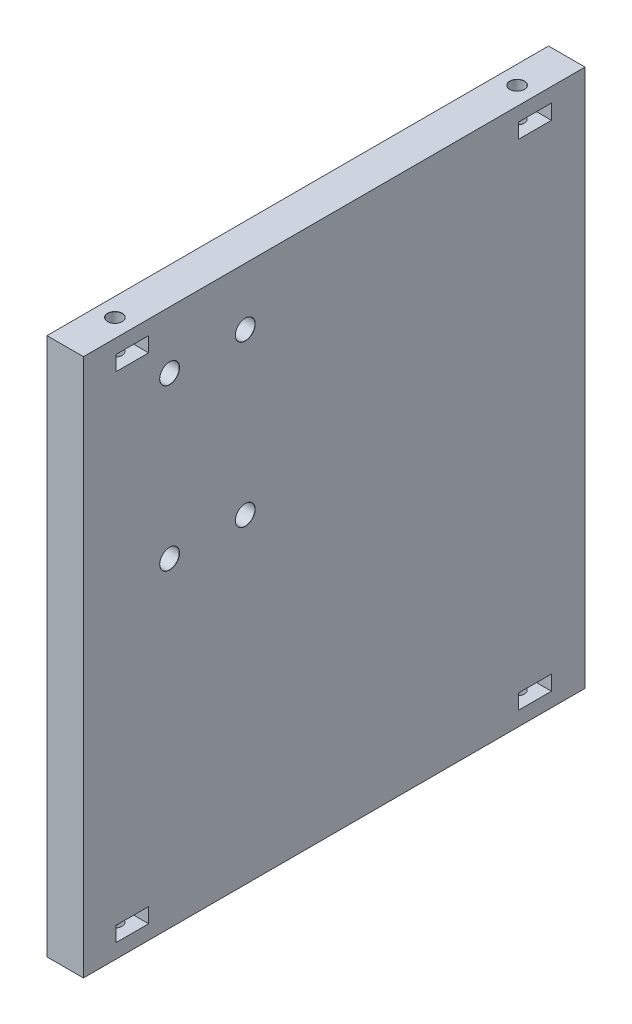
from build123d import *

# Parameters (mm, degrees)
SKETCH1_W                             = 87.3
SKETCH1_H                             = 93.65
BOSS_EXTRUDE1_DEPTH                   = 6.35
TAP_DRILL_FOR_M3X0_5_TAP1_D           = 2.5
TAP_DRILL_FOR_M3X0_5_TAP1_DEPTH       = 10
TAP_DRILL_FOR_M3X0_5_TAP1_CSINK_D     = 2.55
TAP_DRILL_FOR_M3X0_5_TAP1_CSINK_ANGLE = 90
TAP_DRILL_FOR_M3X0_5_TAP1_TIP         = 0.751075774
TAP_DRILL_FOR_M3X0_5_TAP2_D           = 2.5
TAP_DRILL_FOR_M3X0_5_TAP2_DEPTH       = 9.248924226
TAP_DRILL_FOR_M3X0_5_TAP2_CSINK_D     = 2.55
TAP_DRILL_FOR_M3X0_5_TAP2_CSINK_ANGLE = 90
TAP_DRILL_FOR_M3X0_5_TAP2_TIP         = 0.751075774
M3_CLEARANCE_HOLE2_D                  = 3.4
M3_CLEARANCE_HOLE2_CSINK_D            = 3.45
M3_CLEARANCE_HOLE2_CSINK_ANGLE        = 90
SKETCH24_W                            = 5.7
SKETCH24_H                            = 2.6
CUT_EXTRUDE1_DEPTH                    = 65.329041847


with BuildPart() as part:
    # Sketch1 → Boss-Extrude1 (new body)
    with BuildSketch(Plane(origin=(0, 0, 0), x_dir=(0, 0, -1), z_dir=(1, 0, 0))):
        Rectangle(SKETCH1_W, SKETCH1_H)
    extrude(amount=BOSS_EXTRUDE1_DEPTH)

    # Tap Drill for M3x0.5 Tap1
    with Locations(Plane(origin=(0, 46.825, 0), x_dir=(1, 0, 0), z_dir=(0, 1, 0))):
        with Locations((3.175, 35), (3.175, -35)):
            CounterSinkHole(TAP_DRILL_FOR_M3X0_5_TAP1_D / 2, TAP_DRILL_FOR_M3X0_5_TAP1_CSINK_D / 2, depth=TAP_DRILL_FOR_M3X0_5_TAP1_DEPTH, counter_sink_angle=TAP_DRILL_FOR_M3X0_5_TAP1_CSINK_ANGLE)
            with Locations((0, 0, -(TAP_DRILL_FOR_M3X0_5_TAP1_DEPTH + TAP_DRILL_FOR_M3X0_5_TAP1_TIP / 2))):  # 118° drill point
                Cone(0, TAP_DRILL_FOR_M3X0_5_TAP1_D / 2, TAP_DRILL_FOR_M3X0_5_TAP1_TIP, mode=Mode.SUBTRACT)

    # Tap Drill for M3x0.5 Tap2
    with Locations(Plane(origin=(0, -46.825, 0), x_dir=(-1, 0, 0), z_dir=(0, -1, 0))):
        with Locations((-3.175, -35), (-3.175, 35)):
            CounterSinkHole(TAP_DRILL_FOR_M3X0_5_TAP2_D / 2, TAP_DRILL_FOR_M3X0_5_TAP2_CSINK_D / 2, depth=TAP_DRILL_FOR_M3X0_5_TAP2_DEPTH, counter_sink_angle=TAP_DRILL_FOR_M3X0_5_TAP2_CSINK_ANGLE)
            with Locations((0, 0, -(TAP_DRILL_FOR_M3X0_5_TAP2_DEPTH + TAP_DRILL_FOR_M3X0_5_TAP2_TIP / 2))):  # 118° drill point
                Cone(0, TAP_DRILL_FOR_M3X0_5_TAP2_D / 2, TAP_DRILL_FOR_M3X0_5_TAP2_TIP, mode=Mode.SUBTRACT)

    # M3 Clearance Hole2 (through all)
    with Locations(Plane(origin=(6.35, 0, 0), x_dir=(0, 0, -1), z_dir=(1, 0, 0))):
        with Locations((-28.65, 36.825), (-15.48, 36.825), (-15.48, 8.885), (-28.65, 8.885)):
            CounterSinkHole(M3_CLEARANCE_HOLE2_D / 2, M3_CLEARANCE_HOLE2_CSINK_D / 2, counter_sink_angle=M3_CLEARANCE_HOLE2_CSINK_ANGLE)

    # Sketch24 → Cut-Extrude1 (cut, through all)
    with BuildSketch(Plane(origin=(6.35, 0, 0), x_dir=(0, 0, -1), z_dir=(1, 0, 0))):
        with Locations((34.95, -43.025)):
            Rectangle(SKETCH24_W, SKETCH24_H)
        with Locations((-35.15, -43.025)):
            Rectangle(SKETCH24_W, SKETCH24_H)
        with Locations((-35.15, 43.025)):
            Rectangle(SKETCH24_W, SKETCH24_H)
        with Locations((34.95, 43.025)):
            Rectangle(SKETCH24_W, SKETCH24_H)
    extrude(amount=-CUT_EXTRUDE1_DEPTH, mode=Mode.SUBTRACT)


solid = part.part
